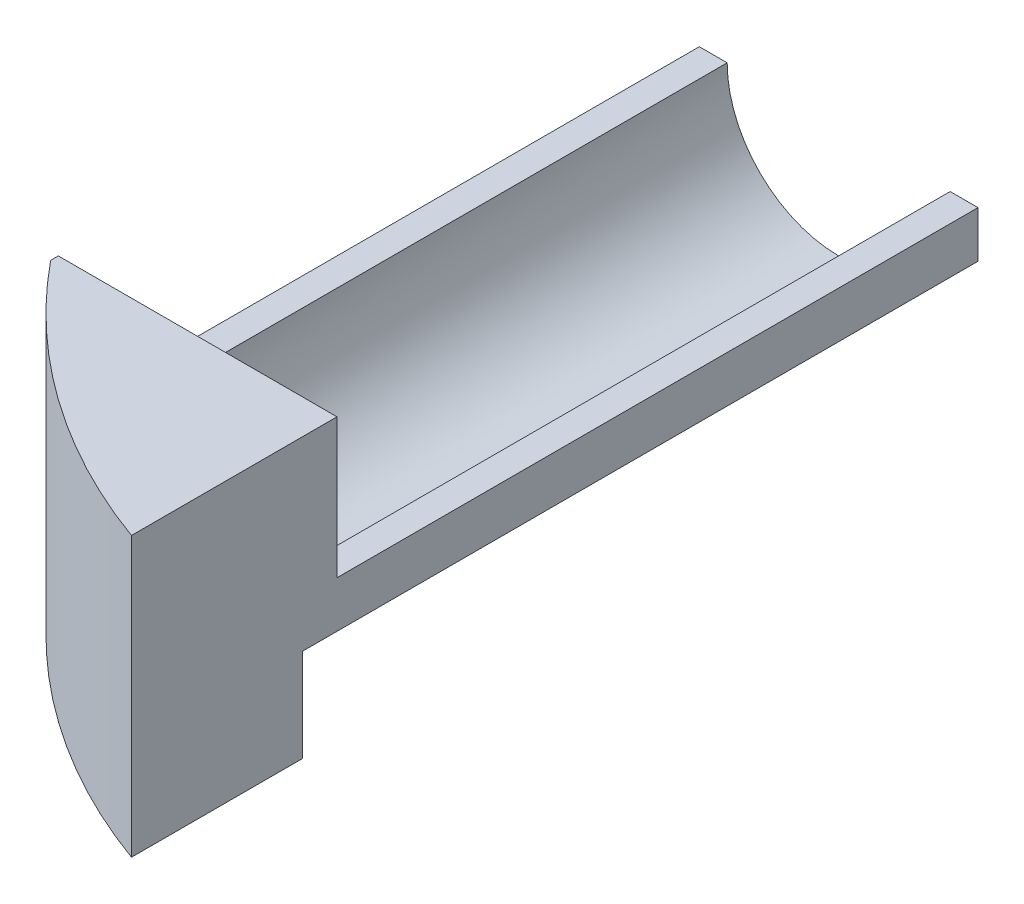
from build123d import *

# Parameters (mm, degrees)
SKETCH2_W           = 30
SKETCH2_H           = 30
BOSS_EXTRUDE1_DEPTH = 100
CUT_EXTRUDE1_START  = -30
CUT_EXTRUDE1_DEPTH  = 30
CUT_EXTRUDE2_DEPTH  = 69
CUT_EXTRUDE3_DEPTH  = 72.7


# Read off the part's stored shape, not the designer's step: Cut-Extrude1
with BuildPart() as part:
    # Sketch2 → Boss-Extrude1 (new body)
    with BuildSketch(Plane.XY):
        with Locations((-15, 15)):
            Rectangle(SKETCH2_W, SKETCH2_H)
    extrude(amount=BOSS_EXTRUDE1_DEPTH)

    # Cut-Extrude1 outline → Cut-Extrude1 (cut)
    with BuildSketch(Plane.XZ.offset(CUT_EXTRUDE1_START)):
        with BuildLine():
            ThreePointArc((-30, 69.824648593), (-16.445900415, 82.511221459), (0, 91.124879576))
            Line((0, 91.124879576), (0, 100))
            Line((0, 100), (-30, 100))
            Line((-30, 100), (-30, 69.824648593))
        make_face()
    extrude(amount=CUT_EXTRUDE1_DEPTH, mode=Mode.SUBTRACT)

    # Sketch4 → Cut-Extrude2 (cut)
    with BuildSketch(Plane(origin=(0, 0, 0), x_dir=(-1, 0, 0), z_dir=(0, 0, -1))):
        with BuildLine():
            Line((3, 15), (0, 15))
            Line((0, 15), (0, 30))
            Line((0, 30), (30, 30))
            Line((30, 30), (30, 15))
            Line((30, 15), (27, 15))
            ThreePointArc((27, 15), (15, 3), (3, 15))
        make_face()
    extrude(amount=-CUT_EXTRUDE2_DEPTH, mode=Mode.SUBTRACT)

    # Sketch5 → Cut-Extrude3 (cut)
    with BuildSketch(Plane(origin=(0, 0, 0), x_dir=(-1, 0, 0), z_dir=(0, 0, -1))):
        Polygon((0, 0), (0, 10), (10, 0), align=None)
    extrude(amount=-CUT_EXTRUDE3_DEPTH, mode=Mode.SUBTRACT)


solid = part.part
